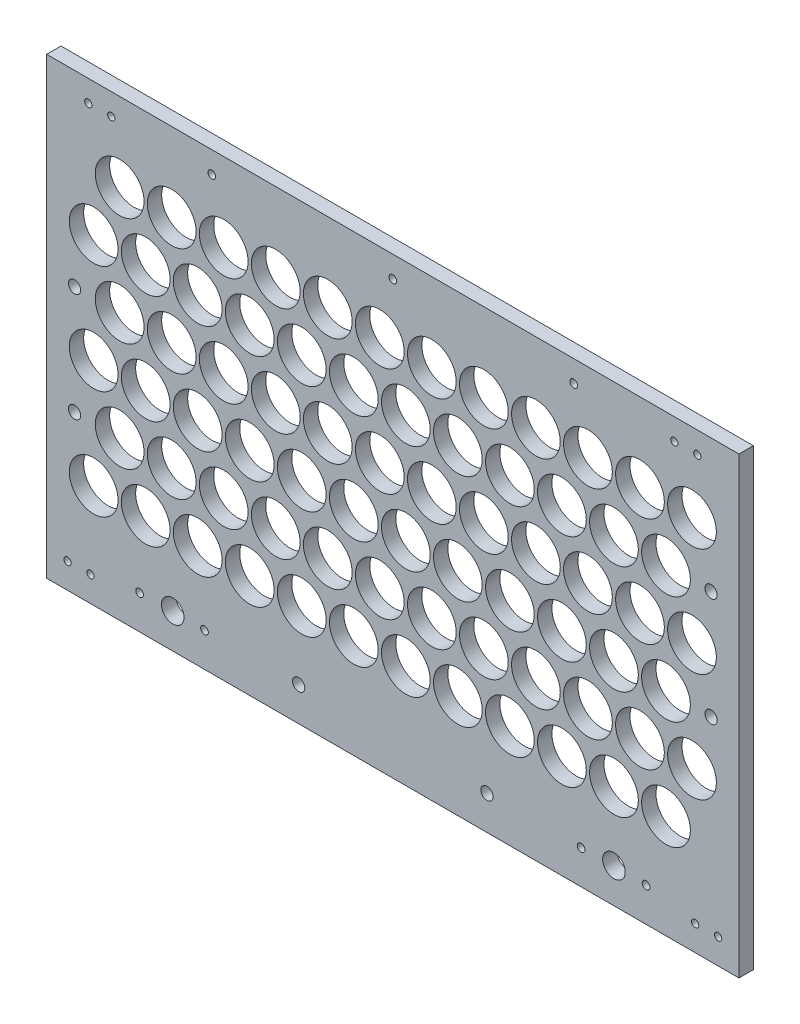
from build123d import *

# Parameters (mm, degrees)
SKETCH1_W                  = 306.05000007
SKETCH1_H                  = 197.4250001
BOSS_EXTRUDE1_DEPTH        = 6.35
CUT_EXTRUDE1_DEPTH         = 187.132543615
SKETCH4_R                  = 10.775
CUT_EXTRUDE2_DEPTH         = 187.132543615
LPATTERN1_COUNT            = 12
LPATTERN1_PITCH            = 23
LPATTERN2_COPY_1_DEPTH     = 187.132543615
LPATTERN2_COPY_2_DEPTH     = 187.132543615
LPATTERN2_COPY_3_DEPTH     = 187.132543615
LPATTERN2_COPY_4_DEPTH     = 187.132543615
LPATTERN2_COPY_5_DEPTH     = 187.132543615
LPATTERN2_COPY_6_DEPTH     = 187.132543615
LPATTERN2_COPY_7_DEPTH     = 187.132543615
LPATTERN2_COPY_8_DEPTH     = 187.132543615
LPATTERN2_COPY_9_DEPTH     = 187.132543615
LPATTERN2_COPY_10_DEPTH    = 187.132543615
LPATTERN2_COPY_11_DEPTH    = 187.132543615
LPATTERN2_COPY_12_DEPTH    = 187.132543615
LPATTERN2_COPY_13_DEPTH    = 187.132543615
LPATTERN2_COPY_14_DEPTH    = 187.132543615
LPATTERN2_COPY_15_DEPTH    = 187.132543615
LPATTERN2_COPY_16_DEPTH    = 187.132543615
LPATTERN2_COPY_17_DEPTH    = 187.132543615
LPATTERN2_COPY_18_DEPTH    = 187.132543615
LPATTERN2_COPY_19_DEPTH    = 187.132543615
LPATTERN2_COPY_20_DEPTH    = 187.132543615
LPATTERN2_COPY_21_DEPTH    = 187.132543615
LPATTERN2_COPY_22_DEPTH    = 187.132543615
LPATTERN2_COPY_23_SKETCH_R = 10.775
LPATTERN2_COPY_23_DEPTH    = 187.132543615
LPATTERN2_COPY_24_SKETCH_R = 10.775
LPATTERN2_COPY_24_DEPTH    = 187.132543615
LPATTERN2_COPY_25_SKETCH_R = 10.775
LPATTERN2_COPY_25_DEPTH    = 187.132543615
LPATTERN2_COPY_26_SKETCH_R = 10.775
LPATTERN2_COPY_26_DEPTH    = 187.132543615
LPATTERN2_COPY_27_SKETCH_R = 10.775
LPATTERN2_COPY_27_DEPTH    = 187.132543615
LPATTERN2_COPY_28_SKETCH_R = 10.775
LPATTERN2_COPY_28_DEPTH    = 187.132543615
LPATTERN2_COPY_29_SKETCH_R = 10.775
LPATTERN2_COPY_29_DEPTH    = 187.132543615
LPATTERN2_COPY_30_SKETCH_R = 10.775
LPATTERN2_COPY_30_DEPTH    = 187.132543615
LPATTERN2_COPY_31_SKETCH_R = 10.775
LPATTERN2_COPY_31_DEPTH    = 187.132543615
LPATTERN2_COPY_32_SKETCH_R = 10.775
LPATTERN2_COPY_32_DEPTH    = 187.132543615
LPATTERN2_COPY_33_SKETCH_R = 10.775
LPATTERN2_COPY_33_DEPTH    = 187.132543615
LPATTERN2_COPY_34_SKETCH_R = 10.775
LPATTERN2_COPY_34_DEPTH    = 187.132543615
LPATTERN2_COPY_35_SKETCH_R = 10.775
LPATTERN2_COPY_35_DEPTH    = 187.132543615
LPATTERN2_COPY_36_SKETCH_R = 10.775
LPATTERN2_COPY_36_DEPTH    = 187.132543615
LPATTERN2_COPY_37_SKETCH_R = 10.775
LPATTERN2_COPY_37_DEPTH    = 187.132543615
LPATTERN2_COPY_38_SKETCH_R = 10.775
LPATTERN2_COPY_38_DEPTH    = 187.132543615
LPATTERN2_COPY_39_SKETCH_R = 10.775
LPATTERN2_COPY_39_DEPTH    = 187.132543615
LPATTERN2_COPY_40_SKETCH_R = 10.775
LPATTERN2_COPY_40_DEPTH    = 187.132543615
LPATTERN2_COPY_41_SKETCH_R = 10.775
LPATTERN2_COPY_41_DEPTH    = 187.132543615
LPATTERN2_COPY_42_SKETCH_R = 10.775
LPATTERN2_COPY_42_DEPTH    = 187.132543615
LPATTERN2_COPY_43_SKETCH_R = 10.775
LPATTERN2_COPY_43_DEPTH    = 187.132543615
LPATTERN2_COPY_44_SKETCH_R = 10.775
LPATTERN2_COPY_44_DEPTH    = 187.132543615
LPATTERN2_COPY_45_DEPTH    = 187.132543615
LPATTERN2_COPY_46_DEPTH    = 187.132543615
LPATTERN2_COPY_47_SKETCH_R = 10.775
LPATTERN2_COPY_47_DEPTH    = 187.132543615
LPATTERN2_COPY_48_SKETCH_R = 10.775
LPATTERN2_COPY_48_DEPTH    = 187.132543615
SKETCH5_R                  = 5
CUT_EXTRUDE3_DEPTH         = 187.132543615
M3_CLEARANCE_HOLE1_D       = 3.4
M3_CLEARANCE_HOLE2_D       = 3.2
SKETCH12_R                 = 2.7
CUT_EXTRUDE4_DEPTH         = 187.132543615
SKETCH13_W                 = 306.05000007
SKETCH13_H                 = 6.35
BOSS_EXTRUDE2_DEPTH        = 3.175


with BuildPart() as part:
    # Sketch1 → Boss-Extrude1 (new body)
    with BuildSketch(Plane.XY):
        with Locations((3.5e-08, -7.06250005)):
            Rectangle(SKETCH1_W, SKETCH1_H)
    extrude(amount=BOSS_EXTRUDE1_DEPTH)

    # Sketch3 → Cut-Extrude1 (cut, through all)
    with BuildSketch(Plane.XY.offset(6.35)):
        with BuildLine():
            ThreePointArc((-121.475, -60), (-132.24999993, -49.225), (-143.025, -59.999999859))
            ThreePointArc((-143.025, -59.999999859), (-139.869075617, -67.619075517), (-132.25, -70.775))
            ThreePointArc((-132.25, -70.775), (-124.630924433, -67.619075567), (-121.475, -60))
        make_face()
    cut_extrude1 = extrude(amount=-CUT_EXTRUDE1_DEPTH, mode=Mode.SUBTRACT)

    # Sketch4 → Cut-Extrude2 (cut, through all)
    with BuildSketch(Plane.XY.offset(6.35)):
        with Locations((-120.75, -36)):
            Circle(SKETCH4_R)
    cut_extrude2 = extrude(amount=-CUT_EXTRUDE2_DEPTH, mode=Mode.SUBTRACT)

    # LPattern1: Cut-Extrude1, Cut-Extrude2 ×12
    with Locations(*[(i * LPATTERN1_PITCH, 0, 0) for i in range(1, LPATTERN1_COUNT)]):
        add(cut_extrude1, mode=Mode.SUBTRACT)
        add(cut_extrude2, mode=Mode.SUBTRACT)

    # LPattern2 copy 1 sketch → LPattern2 copy 1 (cut, through all)
    with BuildSketch(Plane(origin=(23, 48, 6.35), x_dir=(1, 0, 0), z_dir=(0, 0, 1))):
        with BuildLine():
            ThreePointArc((-121.475, -60), (-132.24999993, -49.225), (-143.025, -59.999999859))
            ThreePointArc((-143.025, -59.999999859), (-139.869075617, -67.619075517), (-132.25, -70.775))
            ThreePointArc((-132.25, -70.775), (-124.630924433, -67.619075567), (-121.475, -60))
        make_face()
    extrude(amount=-LPATTERN2_COPY_1_DEPTH, mode=Mode.SUBTRACT)

    # LPattern2 copy 2 sketch → LPattern2 copy 2 (cut, through all)
    with BuildSketch(Plane(origin=(23, 96, 6.35), x_dir=(1, 0, 0), z_dir=(0, 0, 1))):
        with BuildLine():
            ThreePointArc((-121.475, -60), (-132.24999993, -49.225), (-143.025, -59.999999859))
            ThreePointArc((-143.025, -59.999999859), (-139.869075617, -67.619075517), (-132.25, -70.775))
            ThreePointArc((-132.25, -70.775), (-124.630924433, -67.619075567), (-121.475, -60))
        make_face()
    extrude(amount=-LPATTERN2_COPY_2_DEPTH, mode=Mode.SUBTRACT)

    # LPattern2 copy 3 sketch → LPattern2 copy 3 (cut, through all)
    with BuildSketch(Plane(origin=(46, 48, 6.35), x_dir=(1, 0, 0), z_dir=(0, 0, 1))):
        with BuildLine():
            ThreePointArc((-121.475, -60), (-132.24999993, -49.225), (-143.025, -59.999999859))
            ThreePointArc((-143.025, -59.999999859), (-139.869075617, -67.619075517), (-132.25, -70.775))
            ThreePointArc((-132.25, -70.775), (-124.630924433, -67.619075567), (-121.475, -60))
        make_face()
    extrude(amount=-LPATTERN2_COPY_3_DEPTH, mode=Mode.SUBTRACT)

    # LPattern2 copy 4 sketch → LPattern2 copy 4 (cut, through all)
    with BuildSketch(Plane(origin=(46, 96, 6.35), x_dir=(1, 0, 0), z_dir=(0, 0, 1))):
        with BuildLine():
            ThreePointArc((-121.475, -60), (-132.24999993, -49.225), (-143.025, -59.999999859))
            ThreePointArc((-143.025, -59.999999859), (-139.869075617, -67.619075517), (-132.25, -70.775))
            ThreePointArc((-132.25, -70.775), (-124.630924433, -67.619075567), (-121.475, -60))
        make_face()
    extrude(amount=-LPATTERN2_COPY_4_DEPTH, mode=Mode.SUBTRACT)

    # LPattern2 copy 5 sketch → LPattern2 copy 5 (cut, through all)
    with BuildSketch(Plane(origin=(69, 48, 6.35), x_dir=(1, 0, 0), z_dir=(0, 0, 1))):
        with BuildLine():
            ThreePointArc((-121.475, -60), (-132.24999993, -49.225), (-143.025, -59.999999859))
            ThreePointArc((-143.025, -59.999999859), (-139.869075617, -67.619075517), (-132.25, -70.775))
            ThreePointArc((-132.25, -70.775), (-124.630924433, -67.619075567), (-121.475, -60))
        make_face()
    extrude(amount=-LPATTERN2_COPY_5_DEPTH, mode=Mode.SUBTRACT)

    # LPattern2 copy 6 sketch → LPattern2 copy 6 (cut, through all)
    with BuildSketch(Plane(origin=(69, 96, 6.35), x_dir=(1, 0, 0), z_dir=(0, 0, 1))):
        with BuildLine():
            ThreePointArc((-121.475, -60), (-132.24999993, -49.225), (-143.025, -59.999999859))
            ThreePointArc((-143.025, -59.999999859), (-139.869075617, -67.619075517), (-132.25, -70.775))
            ThreePointArc((-132.25, -70.775), (-124.630924433, -67.619075567), (-121.475, -60))
        make_face()
    extrude(amount=-LPATTERN2_COPY_6_DEPTH, mode=Mode.SUBTRACT)

    # LPattern2 copy 7 sketch → LPattern2 copy 7 (cut, through all)
    with BuildSketch(Plane(origin=(92, 48, 6.35), x_dir=(1, 0, 0), z_dir=(0, 0, 1))):
        with BuildLine():
            ThreePointArc((-121.475, -60), (-132.24999993, -49.225), (-143.025, -59.999999859))
            ThreePointArc((-143.025, -59.999999859), (-139.869075617, -67.619075517), (-132.25, -70.775))
            ThreePointArc((-132.25, -70.775), (-124.630924433, -67.619075567), (-121.475, -60))
        make_face()
    extrude(amount=-LPATTERN2_COPY_7_DEPTH, mode=Mode.SUBTRACT)

    # LPattern2 copy 8 sketch → LPattern2 copy 8 (cut, through all)
    with BuildSketch(Plane(origin=(92, 96, 6.35), x_dir=(1, 0, 0), z_dir=(0, 0, 1))):
        with BuildLine():
            ThreePointArc((-121.475, -60), (-132.24999993, -49.225), (-143.025, -59.999999859))
            ThreePointArc((-143.025, -59.999999859), (-139.869075617, -67.619075517), (-132.25, -70.775))
            ThreePointArc((-132.25, -70.775), (-124.630924433, -67.619075567), (-121.475, -60))
        make_face()
    extrude(amount=-LPATTERN2_COPY_8_DEPTH, mode=Mode.SUBTRACT)

    # LPattern2 copy 9 sketch → LPattern2 copy 9 (cut, through all)
    with BuildSketch(Plane(origin=(115, 48, 6.35), x_dir=(1, 0, 0), z_dir=(0, 0, 1))):
        with BuildLine():
            ThreePointArc((-121.475, -60), (-132.24999993, -49.225), (-143.025, -59.999999859))
            ThreePointArc((-143.025, -59.999999859), (-139.869075617, -67.619075517), (-132.25, -70.775))
            ThreePointArc((-132.25, -70.775), (-124.630924433, -67.619075567), (-121.475, -60))
        make_face()
    extrude(amount=-LPATTERN2_COPY_9_DEPTH, mode=Mode.SUBTRACT)

    # LPattern2 copy 10 sketch → LPattern2 copy 10 (cut, through all)
    with BuildSketch(Plane(origin=(115, 96, 6.35), x_dir=(1, 0, 0), z_dir=(0, 0, 1))):
        with BuildLine():
            ThreePointArc((-121.475, -60), (-132.24999993, -49.225), (-143.025, -59.999999859))
            ThreePointArc((-143.025, -59.999999859), (-139.869075617, -67.619075517), (-132.25, -70.775))
            ThreePointArc((-132.25, -70.775), (-124.630924433, -67.619075567), (-121.475, -60))
        make_face()
    extrude(amount=-LPATTERN2_COPY_10_DEPTH, mode=Mode.SUBTRACT)

    # LPattern2 copy 11 sketch → LPattern2 copy 11 (cut, through all)
    with BuildSketch(Plane(origin=(138, 48, 6.35), x_dir=(1, 0, 0), z_dir=(0, 0, 1))):
        with BuildLine():
            ThreePointArc((-121.475, -60), (-132.24999993, -49.225), (-143.025, -59.999999859))
            ThreePointArc((-143.025, -59.999999859), (-139.869075617, -67.619075517), (-132.25, -70.775))
            ThreePointArc((-132.25, -70.775), (-124.630924433, -67.619075567), (-121.475, -60))
        make_face()
    extrude(amount=-LPATTERN2_COPY_11_DEPTH, mode=Mode.SUBTRACT)

    # LPattern2 copy 12 sketch → LPattern2 copy 12 (cut, through all)
    with BuildSketch(Plane(origin=(138, 96, 6.35), x_dir=(1, 0, 0), z_dir=(0, 0, 1))):
        with BuildLine():
            ThreePointArc((-121.475, -60), (-132.24999993, -49.225), (-143.025, -59.999999859))
            ThreePointArc((-143.025, -59.999999859), (-139.869075617, -67.619075517), (-132.25, -70.775))
            ThreePointArc((-132.25, -70.775), (-124.630924433, -67.619075567), (-121.475, -60))
        make_face()
    extrude(amount=-LPATTERN2_COPY_12_DEPTH, mode=Mode.SUBTRACT)

    # LPattern2 copy 13 sketch → LPattern2 copy 13 (cut, through all)
    with BuildSketch(Plane(origin=(161, 48, 6.35), x_dir=(1, 0, 0), z_dir=(0, 0, 1))):
        with BuildLine():
            ThreePointArc((-121.475, -60), (-132.24999993, -49.225), (-143.025, -59.999999859))
            ThreePointArc((-143.025, -59.999999859), (-139.869075617, -67.619075517), (-132.25, -70.775))
            ThreePointArc((-132.25, -70.775), (-124.630924433, -67.619075567), (-121.475, -60))
        make_face()
    extrude(amount=-LPATTERN2_COPY_13_DEPTH, mode=Mode.SUBTRACT)

    # LPattern2 copy 14 sketch → LPattern2 copy 14 (cut, through all)
    with BuildSketch(Plane(origin=(161, 96, 6.35), x_dir=(1, 0, 0), z_dir=(0, 0, 1))):
        with BuildLine():
            ThreePointArc((-121.475, -60), (-132.24999993, -49.225), (-143.025, -59.999999859))
            ThreePointArc((-143.025, -59.999999859), (-139.869075617, -67.619075517), (-132.25, -70.775))
            ThreePointArc((-132.25, -70.775), (-124.630924433, -67.619075567), (-121.475, -60))
        make_face()
    extrude(amount=-LPATTERN2_COPY_14_DEPTH, mode=Mode.SUBTRACT)

    # LPattern2 copy 15 sketch → LPattern2 copy 15 (cut, through all)
    with BuildSketch(Plane(origin=(184, 48, 6.35), x_dir=(1, 0, 0), z_dir=(0, 0, 1))):
        with BuildLine():
            ThreePointArc((-121.475, -60), (-132.24999993, -49.225), (-143.025, -59.999999859))
            ThreePointArc((-143.025, -59.999999859), (-139.869075617, -67.619075517), (-132.25, -70.775))
            ThreePointArc((-132.25, -70.775), (-124.630924433, -67.619075567), (-121.475, -60))
        make_face()
    extrude(amount=-LPATTERN2_COPY_15_DEPTH, mode=Mode.SUBTRACT)

    # LPattern2 copy 16 sketch → LPattern2 copy 16 (cut, through all)
    with BuildSketch(Plane(origin=(184, 96, 6.35), x_dir=(1, 0, 0), z_dir=(0, 0, 1))):
        with BuildLine():
            ThreePointArc((-121.475, -60), (-132.24999993, -49.225), (-143.025, -59.999999859))
            ThreePointArc((-143.025, -59.999999859), (-139.869075617, -67.619075517), (-132.25, -70.775))
            ThreePointArc((-132.25, -70.775), (-124.630924433, -67.619075567), (-121.475, -60))
        make_face()
    extrude(amount=-LPATTERN2_COPY_16_DEPTH, mode=Mode.SUBTRACT)

    # LPattern2 copy 17 sketch → LPattern2 copy 17 (cut, through all)
    with BuildSketch(Plane(origin=(207, 48, 6.35), x_dir=(1, 0, 0), z_dir=(0, 0, 1))):
        with BuildLine():
            ThreePointArc((-121.475, -60), (-132.24999993, -49.225), (-143.025, -59.999999859))
            ThreePointArc((-143.025, -59.999999859), (-139.869075617, -67.619075517), (-132.25, -70.775))
            ThreePointArc((-132.25, -70.775), (-124.630924433, -67.619075567), (-121.475, -60))
        make_face()
    extrude(amount=-LPATTERN2_COPY_17_DEPTH, mode=Mode.SUBTRACT)

    # LPattern2 copy 18 sketch → LPattern2 copy 18 (cut, through all)
    with BuildSketch(Plane(origin=(207, 96, 6.35), x_dir=(1, 0, 0), z_dir=(0, 0, 1))):
        with BuildLine():
            ThreePointArc((-121.475, -60), (-132.24999993, -49.225), (-143.025, -59.999999859))
            ThreePointArc((-143.025, -59.999999859), (-139.869075617, -67.619075517), (-132.25, -70.775))
            ThreePointArc((-132.25, -70.775), (-124.630924433, -67.619075567), (-121.475, -60))
        make_face()
    extrude(amount=-LPATTERN2_COPY_18_DEPTH, mode=Mode.SUBTRACT)

    # LPattern2 copy 19 sketch → LPattern2 copy 19 (cut, through all)
    with BuildSketch(Plane(origin=(230, 48, 6.35), x_dir=(1, 0, 0), z_dir=(0, 0, 1))):
        with BuildLine():
            ThreePointArc((-121.475, -60), (-132.24999993, -49.225), (-143.025, -59.999999859))
            ThreePointArc((-143.025, -59.999999859), (-139.869075617, -67.619075517), (-132.25, -70.775))
            ThreePointArc((-132.25, -70.775), (-124.630924433, -67.619075567), (-121.475, -60))
        make_face()
    extrude(amount=-LPATTERN2_COPY_19_DEPTH, mode=Mode.SUBTRACT)

    # LPattern2 copy 20 sketch → LPattern2 copy 20 (cut, through all)
    with BuildSketch(Plane(origin=(230, 96, 6.35), x_dir=(1, 0, 0), z_dir=(0, 0, 1))):
        with BuildLine():
            ThreePointArc((-121.475, -60), (-132.24999993, -49.225), (-143.025, -59.999999859))
            ThreePointArc((-143.025, -59.999999859), (-139.869075617, -67.619075517), (-132.25, -70.775))
            ThreePointArc((-132.25, -70.775), (-124.630924433, -67.619075567), (-121.475, -60))
        make_face()
    extrude(amount=-LPATTERN2_COPY_20_DEPTH, mode=Mode.SUBTRACT)

    # LPattern2 copy 21 sketch → LPattern2 copy 21 (cut, through all)
    with BuildSketch(Plane(origin=(253, 48, 6.35), x_dir=(1, 0, 0), z_dir=(0, 0, 1))):
        with BuildLine():
            ThreePointArc((-121.475, -60), (-132.24999993, -49.225), (-143.025, -59.999999859))
            ThreePointArc((-143.025, -59.999999859), (-139.869075617, -67.619075517), (-132.25, -70.775))
            ThreePointArc((-132.25, -70.775), (-124.630924433, -67.619075567), (-121.475, -60))
        make_face()
    extrude(amount=-LPATTERN2_COPY_21_DEPTH, mode=Mode.SUBTRACT)

    # LPattern2 copy 22 sketch → LPattern2 copy 22 (cut, through all)
    with BuildSketch(Plane(origin=(253, 96, 6.35), x_dir=(1, 0, 0), z_dir=(0, 0, 1))):
        with BuildLine():
            ThreePointArc((-121.475, -60), (-132.24999993, -49.225), (-143.025, -59.999999859))
            ThreePointArc((-143.025, -59.999999859), (-139.869075617, -67.619075517), (-132.25, -70.775))
            ThreePointArc((-132.25, -70.775), (-124.630924433, -67.619075567), (-121.475, -60))
        make_face()
    extrude(amount=-LPATTERN2_COPY_22_DEPTH, mode=Mode.SUBTRACT)

    # LPattern2 copy 23 sketch → LPattern2 copy 23 (cut, through all)
    with BuildSketch(Plane(origin=(23, 48, 6.35), x_dir=(1, 0, 0), z_dir=(0, 0, 1))):
        with Locations((-120.75, -36)):
            Circle(LPATTERN2_COPY_23_SKETCH_R)
    extrude(amount=-LPATTERN2_COPY_23_DEPTH, mode=Mode.SUBTRACT)

    # LPattern2 copy 24 sketch → LPattern2 copy 24 (cut, through all)
    with BuildSketch(Plane(origin=(23, 96, 6.35), x_dir=(1, 0, 0), z_dir=(0, 0, 1))):
        with Locations((-120.75, -36)):
            Circle(LPATTERN2_COPY_24_SKETCH_R)
    extrude(amount=-LPATTERN2_COPY_24_DEPTH, mode=Mode.SUBTRACT)

    # LPattern2 copy 25 sketch → LPattern2 copy 25 (cut, through all)
    with BuildSketch(Plane(origin=(46, 48, 6.35), x_dir=(1, 0, 0), z_dir=(0, 0, 1))):
        with Locations((-120.75, -36)):
            Circle(LPATTERN2_COPY_25_SKETCH_R)
    extrude(amount=-LPATTERN2_COPY_25_DEPTH, mode=Mode.SUBTRACT)

    # LPattern2 copy 26 sketch → LPattern2 copy 26 (cut, through all)
    with BuildSketch(Plane(origin=(46, 96, 6.35), x_dir=(1, 0, 0), z_dir=(0, 0, 1))):
        with Locations((-120.75, -36)):
            Circle(LPATTERN2_COPY_26_SKETCH_R)
    extrude(amount=-LPATTERN2_COPY_26_DEPTH, mode=Mode.SUBTRACT)

    # LPattern2 copy 27 sketch → LPattern2 copy 27 (cut, through all)
    with BuildSketch(Plane(origin=(69, 48, 6.35), x_dir=(1, 0, 0), z_dir=(0, 0, 1))):
        with Locations((-120.75, -36)):
            Circle(LPATTERN2_COPY_27_SKETCH_R)
    extrude(amount=-LPATTERN2_COPY_27_DEPTH, mode=Mode.SUBTRACT)

    # LPattern2 copy 28 sketch → LPattern2 copy 28 (cut, through all)
    with BuildSketch(Plane(origin=(69, 96, 6.35), x_dir=(1, 0, 0), z_dir=(0, 0, 1))):
        with Locations((-120.75, -36)):
            Circle(LPATTERN2_COPY_28_SKETCH_R)
    extrude(amount=-LPATTERN2_COPY_28_DEPTH, mode=Mode.SUBTRACT)

    # LPattern2 copy 29 sketch → LPattern2 copy 29 (cut, through all)
    with BuildSketch(Plane(origin=(92, 48, 6.35), x_dir=(1, 0, 0), z_dir=(0, 0, 1))):
        with Locations((-120.75, -36)):
            Circle(LPATTERN2_COPY_29_SKETCH_R)
    extrude(amount=-LPATTERN2_COPY_29_DEPTH, mode=Mode.SUBTRACT)

    # LPattern2 copy 30 sketch → LPattern2 copy 30 (cut, through all)
    with BuildSketch(Plane(origin=(92, 96, 6.35), x_dir=(1, 0, 0), z_dir=(0, 0, 1))):
        with Locations((-120.75, -36)):
            Circle(LPATTERN2_COPY_30_SKETCH_R)
    extrude(amount=-LPATTERN2_COPY_30_DEPTH, mode=Mode.SUBTRACT)

    # LPattern2 copy 31 sketch → LPattern2 copy 31 (cut, through all)
    with BuildSketch(Plane(origin=(115, 48, 6.35), x_dir=(1, 0, 0), z_dir=(0, 0, 1))):
        with Locations((-120.75, -36)):
            Circle(LPATTERN2_COPY_31_SKETCH_R)
    extrude(amount=-LPATTERN2_COPY_31_DEPTH, mode=Mode.SUBTRACT)

    # LPattern2 copy 32 sketch → LPattern2 copy 32 (cut, through all)
    with BuildSketch(Plane(origin=(115, 96, 6.35), x_dir=(1, 0, 0), z_dir=(0, 0, 1))):
        with Locations((-120.75, -36)):
            Circle(LPATTERN2_COPY_32_SKETCH_R)
    extrude(amount=-LPATTERN2_COPY_32_DEPTH, mode=Mode.SUBTRACT)

    # LPattern2 copy 33 sketch → LPattern2 copy 33 (cut, through all)
    with BuildSketch(Plane(origin=(138, 48, 6.35), x_dir=(1, 0, 0), z_dir=(0, 0, 1))):
        with Locations((-120.75, -36)):
            Circle(LPATTERN2_COPY_33_SKETCH_R)
    extrude(amount=-LPATTERN2_COPY_33_DEPTH, mode=Mode.SUBTRACT)

    # LPattern2 copy 34 sketch → LPattern2 copy 34 (cut, through all)
    with BuildSketch(Plane(origin=(138, 96, 6.35), x_dir=(1, 0, 0), z_dir=(0, 0, 1))):
        with Locations((-120.75, -36)):
            Circle(LPATTERN2_COPY_34_SKETCH_R)
    extrude(amount=-LPATTERN2_COPY_34_DEPTH, mode=Mode.SUBTRACT)

    # LPattern2 copy 35 sketch → LPattern2 copy 35 (cut, through all)
    with BuildSketch(Plane(origin=(161, 48, 6.35), x_dir=(1, 0, 0), z_dir=(0, 0, 1))):
        with Locations((-120.75, -36)):
            Circle(LPATTERN2_COPY_35_SKETCH_R)
    extrude(amount=-LPATTERN2_COPY_35_DEPTH, mode=Mode.SUBTRACT)

    # LPattern2 copy 36 sketch → LPattern2 copy 36 (cut, through all)
    with BuildSketch(Plane(origin=(161, 96, 6.35), x_dir=(1, 0, 0), z_dir=(0, 0, 1))):
        with Locations((-120.75, -36)):
            Circle(LPATTERN2_COPY_36_SKETCH_R)
    extrude(amount=-LPATTERN2_COPY_36_DEPTH, mode=Mode.SUBTRACT)

    # LPattern2 copy 37 sketch → LPattern2 copy 37 (cut, through all)
    with BuildSketch(Plane(origin=(184, 48, 6.35), x_dir=(1, 0, 0), z_dir=(0, 0, 1))):
        with Locations((-120.75, -36)):
            Circle(LPATTERN2_COPY_37_SKETCH_R)
    extrude(amount=-LPATTERN2_COPY_37_DEPTH, mode=Mode.SUBTRACT)

    # LPattern2 copy 38 sketch → LPattern2 copy 38 (cut, through all)
    with BuildSketch(Plane(origin=(184, 96, 6.35), x_dir=(1, 0, 0), z_dir=(0, 0, 1))):
        with Locations((-120.75, -36)):
            Circle(LPATTERN2_COPY_38_SKETCH_R)
    extrude(amount=-LPATTERN2_COPY_38_DEPTH, mode=Mode.SUBTRACT)

    # LPattern2 copy 39 sketch → LPattern2 copy 39 (cut, through all)
    with BuildSketch(Plane(origin=(207, 48, 6.35), x_dir=(1, 0, 0), z_dir=(0, 0, 1))):
        with Locations((-120.75, -36)):
            Circle(LPATTERN2_COPY_39_SKETCH_R)
    extrude(amount=-LPATTERN2_COPY_39_DEPTH, mode=Mode.SUBTRACT)

    # LPattern2 copy 40 sketch → LPattern2 copy 40 (cut, through all)
    with BuildSketch(Plane(origin=(207, 96, 6.35), x_dir=(1, 0, 0), z_dir=(0, 0, 1))):
        with Locations((-120.75, -36)):
            Circle(LPATTERN2_COPY_40_SKETCH_R)
    extrude(amount=-LPATTERN2_COPY_40_DEPTH, mode=Mode.SUBTRACT)

    # LPattern2 copy 41 sketch → LPattern2 copy 41 (cut, through all)
    with BuildSketch(Plane(origin=(230, 48, 6.35), x_dir=(1, 0, 0), z_dir=(0, 0, 1))):
        with Locations((-120.75, -36)):
            Circle(LPATTERN2_COPY_41_SKETCH_R)
    extrude(amount=-LPATTERN2_COPY_41_DEPTH, mode=Mode.SUBTRACT)

    # LPattern2 copy 42 sketch → LPattern2 copy 42 (cut, through all)
    with BuildSketch(Plane(origin=(230, 96, 6.35), x_dir=(1, 0, 0), z_dir=(0, 0, 1))):
        with Locations((-120.75, -36)):
            Circle(LPATTERN2_COPY_42_SKETCH_R)
    extrude(amount=-LPATTERN2_COPY_42_DEPTH, mode=Mode.SUBTRACT)

    # LPattern2 copy 43 sketch → LPattern2 copy 43 (cut, through all)
    with BuildSketch(Plane(origin=(253, 48, 6.35), x_dir=(1, 0, 0), z_dir=(0, 0, 1))):
        with Locations((-120.75, -36)):
            Circle(LPATTERN2_COPY_43_SKETCH_R)
    extrude(amount=-LPATTERN2_COPY_43_DEPTH, mode=Mode.SUBTRACT)

    # LPattern2 copy 44 sketch → LPattern2 copy 44 (cut, through all)
    with BuildSketch(Plane(origin=(253, 96, 6.35), x_dir=(1, 0, 0), z_dir=(0, 0, 1))):
        with Locations((-120.75, -36)):
            Circle(LPATTERN2_COPY_44_SKETCH_R)
    extrude(amount=-LPATTERN2_COPY_44_DEPTH, mode=Mode.SUBTRACT)

    # LPattern2 copy 45 sketch → LPattern2 copy 45 (cut, through all)
    with BuildSketch(Plane(origin=(0, 48, 6.35), x_dir=(1, 0, 0), z_dir=(0, 0, 1))):
        with BuildLine():
            ThreePointArc((-121.475, -60), (-132.24999993, -49.225), (-143.025, -59.999999859))
            ThreePointArc((-143.025, -59.999999859), (-139.869075617, -67.619075517), (-132.25, -70.775))
            ThreePointArc((-132.25, -70.775), (-124.630924433, -67.619075567), (-121.475, -60))
        make_face()
    extrude(amount=-LPATTERN2_COPY_45_DEPTH, mode=Mode.SUBTRACT)

    # LPattern2 copy 46 sketch → LPattern2 copy 46 (cut, through all)
    with BuildSketch(Plane(origin=(0, 96, 6.35), x_dir=(1, 0, 0), z_dir=(0, 0, 1))):
        with BuildLine():
            ThreePointArc((-121.475, -60), (-132.24999993, -49.225), (-143.025, -59.999999859))
            ThreePointArc((-143.025, -59.999999859), (-139.869075617, -67.619075517), (-132.25, -70.775))
            ThreePointArc((-132.25, -70.775), (-124.630924433, -67.619075567), (-121.475, -60))
        make_face()
    extrude(amount=-LPATTERN2_COPY_46_DEPTH, mode=Mode.SUBTRACT)

    # LPattern2 copy 47 sketch → LPattern2 copy 47 (cut, through all)
    with BuildSketch(Plane(origin=(0, 48, 6.35), x_dir=(1, 0, 0), z_dir=(0, 0, 1))):
        with Locations((-120.75, -36)):
            Circle(LPATTERN2_COPY_47_SKETCH_R)
    extrude(amount=-LPATTERN2_COPY_47_DEPTH, mode=Mode.SUBTRACT)

    # LPattern2 copy 48 sketch → LPattern2 copy 48 (cut, through all)
    with BuildSketch(Plane(origin=(0, 96, 6.35), x_dir=(1, 0, 0), z_dir=(0, 0, 1))):
        with Locations((-120.75, -36)):
            Circle(LPATTERN2_COPY_48_SKETCH_R)
    extrude(amount=-LPATTERN2_COPY_48_DEPTH, mode=Mode.SUBTRACT)

    # Sketch5 → Cut-Extrude3 (cut, through all)
    with BuildSketch(Plane(origin=(0, 0, 0), x_dir=(-1, 0, 0), z_dir=(0, 0, -1))):
        with Locations((-97.75, -90.3965)):
            Circle(SKETCH5_R)
        with Locations((97.288, -90.3965)):
            Circle(SKETCH5_R)
    extrude(amount=-CUT_EXTRUDE3_DEPTH, mode=Mode.SUBTRACT)

    # M3 Clearance Hole1 (through all)
    with Locations(Plane(origin=(0, 0, 0), x_dir=(-1, 0, 0), z_dir=(0, 0, -1))):
        with Locations((-111.94, -90.775), (80, 85.3), (0, 85.3), (-80, 85.3), (-83.25, -90.775), (111.94, -90.775), (83.25, -90.775)):
            Hole(M3_CLEARANCE_HOLE1_D / 2)

    # M3 Clearance Hole2 (through all)
    with Locations(Plane(origin=(0, 0, 0), x_dir=(-1, 0, 0), z_dir=(0, 0, -1))):
        with Locations((-143.817500066, -94.6000001), (-133.657500066, -94.6000001), (-134.610000066, 85.3), (-124.450000066, 85.3), (124.450000066, 85.3), (134.610000066, 85.3), (133.657500066, -94.6000001), (143.817500066, -94.6000001)):
            Hole(M3_CLEARANCE_HOLE2_D / 2)

    # Sketch12 → Cut-Extrude4 (cut, through all)
    with BuildSketch(Plane(origin=(0, 0, 0), x_dir=(-1, 0, 0), z_dir=(0, 0, -1))):
        with Locations((41.625, -90.775)):
            Circle(SKETCH12_R)
        with Locations((-41.625, -90.775)):
            Circle(SKETCH12_R)
        with Locations((140.687500033, -36)):
            Circle(SKETCH12_R)
        with Locations((-140.687500033, 36)):
            Circle(SKETCH12_R)
        with Locations((140.687500033, 12)):
            Circle(SKETCH12_R)
        with Locations((-140.687500033, -12)):
            Circle(SKETCH12_R)
    extrude(amount=-CUT_EXTRUDE4_DEPTH, mode=Mode.SUBTRACT)

    # Sketch13 → Boss-Extrude2 (add)
    with BuildSketch(Plane(origin=(0, 91.65, 0), x_dir=(1, 0, 0), z_dir=(0, 1, 0))):
        with Locations((3.5e-08, -3.175)):
            Rectangle(SKETCH13_W, SKETCH13_H)
    extrude(amount=BOSS_EXTRUDE2_DEPTH)


solid = part.part
